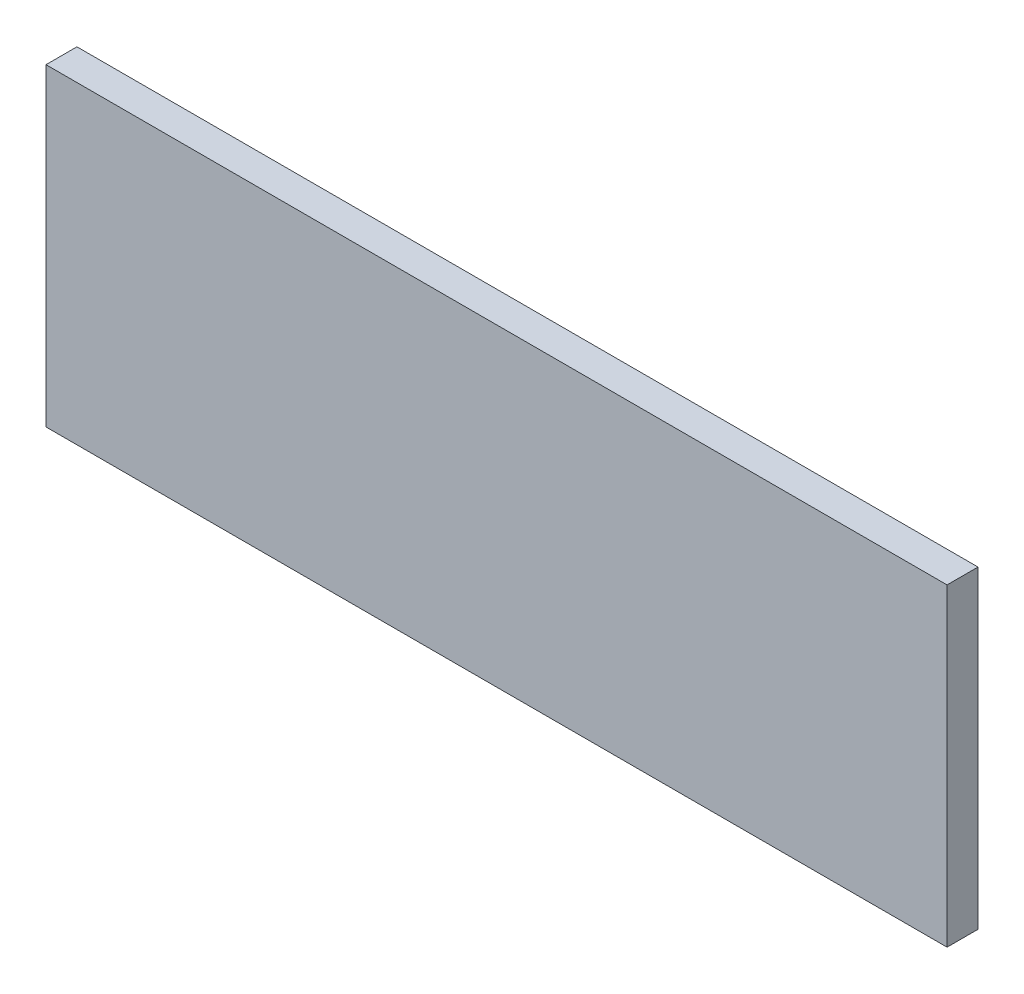
from build123d import *

# Parameters (mm, degrees)
SKETCH2_W           = 92.456
SKETCH2_H           = 32.1945
BOSS_EXTRUDE1_DEPTH = 3.175


with BuildPart() as part:
    # Sketch2 → Boss-Extrude1 (new body)
    with BuildSketch(Plane.XY):
        Rectangle(SKETCH2_W, SKETCH2_H)
    extrude(amount=BOSS_EXTRUDE1_DEPTH)


solid = part.part
